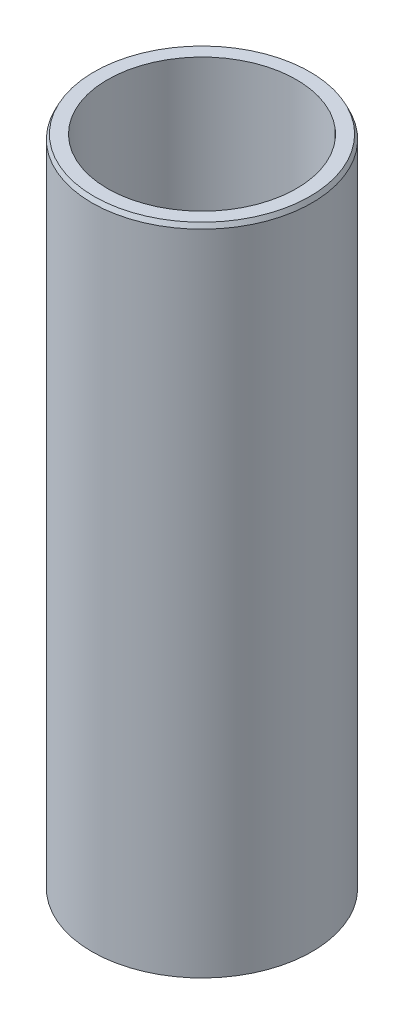
from build123d import *
from OCP.BRepFilletAPI import BRepFilletAPI_MakeChamfer

# Parameters (mm, degrees)
SKETCH1_R           = 57.5
BOSS_EXTRUDE1_DEPTH = 342.23166885
SKETCH2_R           = 49.328438027
CUT_EXTRUDE1_DEPTH  = 352.759882823
CHAMFER1_SIZE       = 2.366638196
CHAMFER1_SIZE2      = 1.118881429


with BuildPart() as part:
    # Sketch1 → Boss-Extrude1 (new body)
    with BuildSketch(Plane(origin=(0, 0, 0), x_dir=(1, 0, 0), z_dir=(0, 1, 0))):
        Circle(SKETCH1_R)
    extrude(amount=BOSS_EXTRUDE1_DEPTH)

    # Sketch2 → Cut-Extrude1 (cut, through all)
    with BuildSketch(Plane(origin=(0, 0, 0), x_dir=(1, 0, 0), z_dir=(0, 1, 0))):
        Circle(SKETCH2_R)
    extrude(amount=CUT_EXTRUDE1_DEPTH, mode=Mode.SUBTRACT)

    # Chamfer1: one chamfer whose edges measure the first distance from different faces: ONE call of the kernel's chamfer builder (chamfer() names one face for all edges)
    chamfer1_edges_1 = [part.edges().sort_by_distance(p)[0] for p in [
        (-57.5, 342.23166885, 0),
    ]]
    chamfer1_side_1 = [part.faces().sort_by_distance(p)[0] for p in [
        (-57.5, 171.115834425, 0),
    ]]
    chamfer1_edges_2 = [part.edges().sort_by_distance(p)[0] for p in [
        (-57.5, 0, 0),
    ]]
    chamfer1_side_2 = [part.faces().sort_by_distance(p)[0] for p in [
        (-55.873654403, 0, 0),
    ]]
    chamfer1 = BRepFilletAPI_MakeChamfer(part.part.solid().wrapped)
    for e in chamfer1_edges_1:
        chamfer1.Add(CHAMFER1_SIZE, CHAMFER1_SIZE2, e.wrapped, chamfer1_side_1[0].wrapped)  # the first distance lies on this face
    for e in chamfer1_edges_2:
        chamfer1.Add(CHAMFER1_SIZE, CHAMFER1_SIZE2, e.wrapped, chamfer1_side_2[0].wrapped)  # the first distance lies on this face
    add(Compound.cast(chamfer1.Shape()), mode=Mode.REPLACE)


solid = part.part
